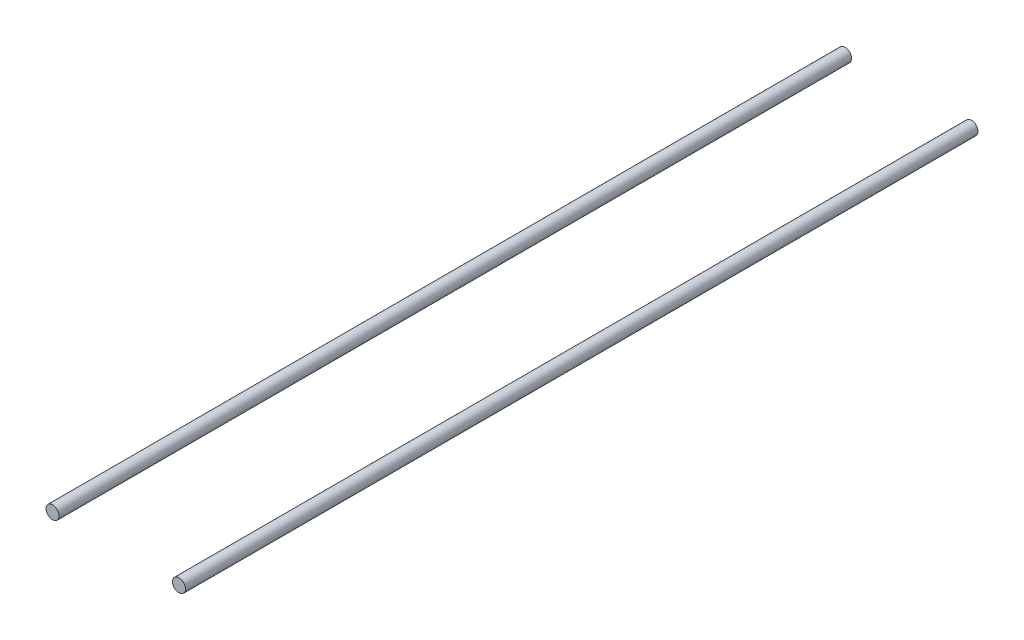
from build123d import *

# Parameters (mm, degrees)
BOSS_EXTRUDE2_OUTLINE_R   = 6.35
BOSS_EXTRUDE2_DEPTH       = 770.6741
BOSS_EXTRUDE2_2_OUTLINE_R = 6.35
BOSS_EXTRUDE2_2_DEPTH     = 770.6741


with BuildPart() as part:
    # Boss-Extrude2: read off the stored shape, not the designer's step
    # Boss-Extrude2 outline → Boss-Extrude2 (new body)
    with BuildSketch(Plane.XY.offset(-722.376)):
        with Locations((86.868, -20.93468)):
            Circle(BOSS_EXTRUDE2_OUTLINE_R)
    extrude(amount=BOSS_EXTRUDE2_DEPTH)


with BuildPart() as body_2:
    # Boss-Extrude2 2 outline → Boss-Extrude2 2 (new body)
    with BuildSketch(Plane.XY.offset(-722.376)):
        with Locations((-36.068, -20.93468)):
            Circle(BOSS_EXTRUDE2_2_OUTLINE_R)
    extrude(amount=BOSS_EXTRUDE2_2_DEPTH)


solid = Compound([part.part, body_2.part])
